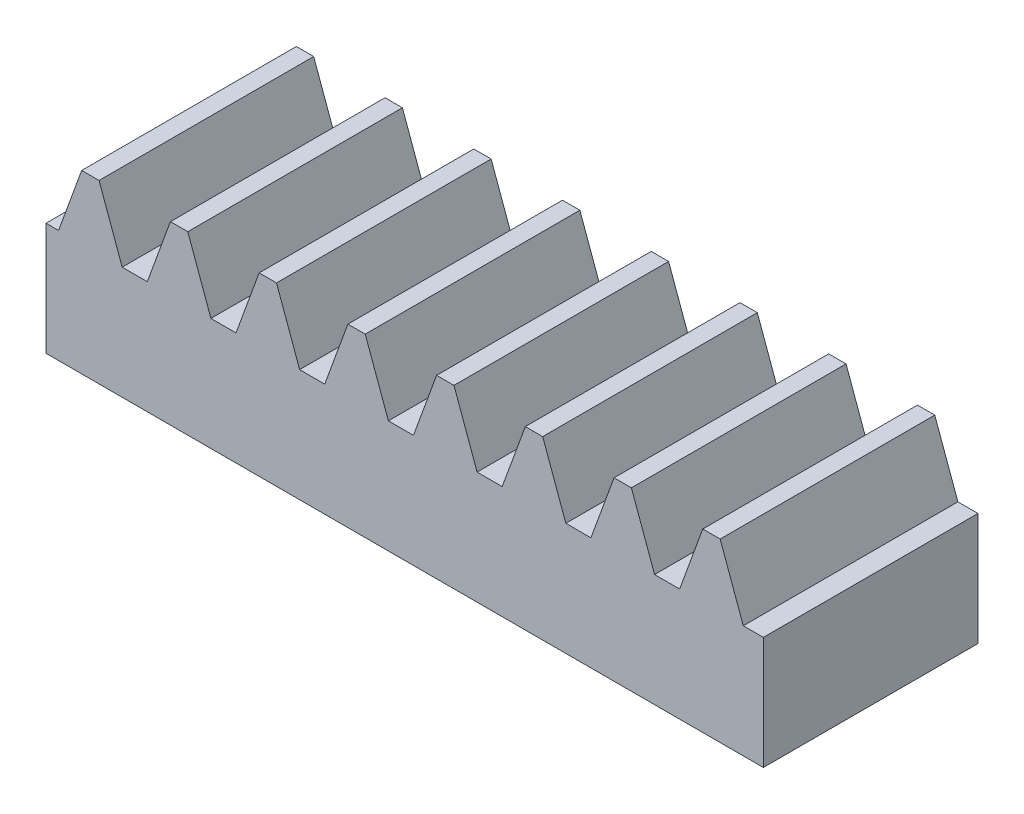
from build123d import *

# Parameters (mm, degrees)
BLANKSKE_W        = 12.7
BLANKSKE_H        = 3.12
BLANK_DEPTH       = 3.8
TOOTHCUTSIM_DEPTH = 14.618531492
TEETHCUTS_COUNT   = 10
TEETHCUTS_PITCH   = 1.570796325


with BuildPart() as part:
    # BlankSke → Blank (new body)
    with BuildSketch(Plane.XY):
        with Locations((6.35, 1.56)):
            Rectangle(BLANKSKE_W, BLANKSKE_H)
    extrude(amount=-BLANK_DEPTH)

    # TooCutSkeSim → ToothCutSim (cut, through all)
    with BuildSketch(Plane.XY):
        Polygon((0.222217685, 1.995), (-0.222217685, 1.995), (-0.640929042, 3.1454), (0.640929042, 3.1454), align=None)
    toothcutsim = extrude(amount=-TOOTHCUTSIM_DEPTH, mode=Mode.SUBTRACT)

    # TeethCuts: ToothCutSim ×10
    with Locations(*[(i * TEETHCUTS_PITCH, 0, 0) for i in range(1, TEETHCUTS_COUNT)]):
        add(toothcutsim, mode=Mode.SUBTRACT)


solid = part.part
